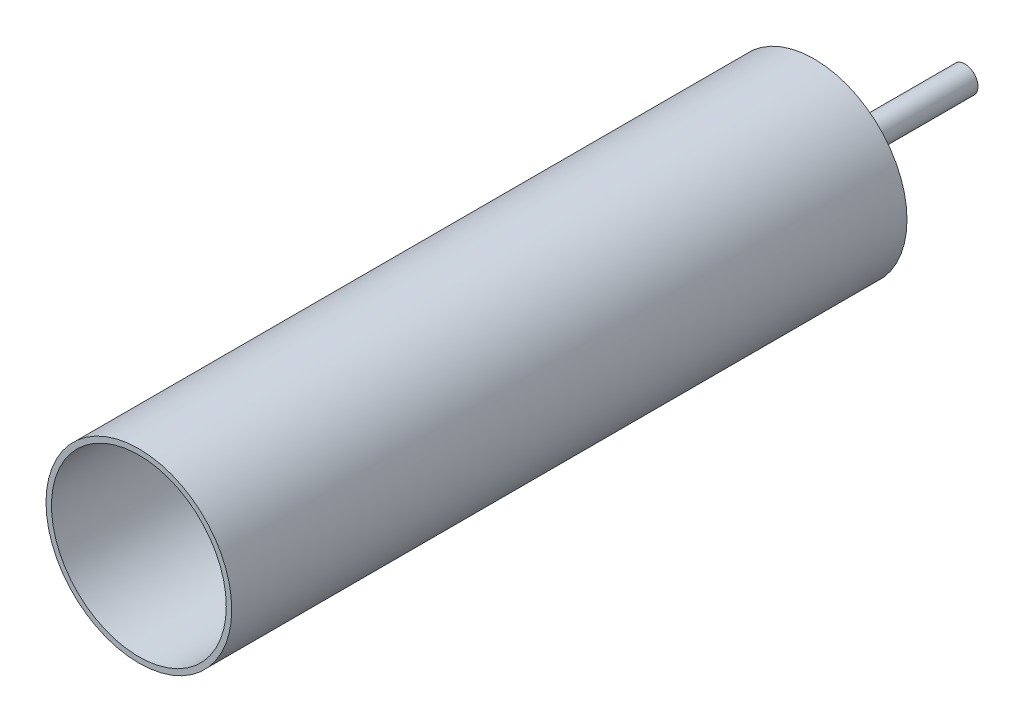
from build123d import *

# Parameters (mm, degrees)
SKETCH1_R           = 21.59
BOSS_EXTRUDE1_DEPTH = 156.972
SKETCH2_R           = 3.048
BOSS_EXTRUDE2_DEPTH = 35.052
SKETCH5_R           = 20.32
CUT_EXTRUDE1_DEPTH  = 152.4


with BuildPart() as part:
    # Sketch1 → Boss-Extrude1 (new body)
    with BuildSketch(Plane.XY):
        Circle(SKETCH1_R)
    extrude(amount=-BOSS_EXTRUDE1_DEPTH)

    # Sketch2 → Boss-Extrude2 (add)
    with BuildSketch(Plane(origin=(0, 0, -156.972), x_dir=(-1, 0, 0), z_dir=(0, 0, -1))):
        Circle(SKETCH2_R)
    extrude(amount=BOSS_EXTRUDE2_DEPTH)

    # Sketch5 → Cut-Extrude1 (cut)
    with BuildSketch(Plane.XY):
        Circle(SKETCH5_R)
    extrude(amount=-CUT_EXTRUDE1_DEPTH, mode=Mode.SUBTRACT)


solid = part.part
